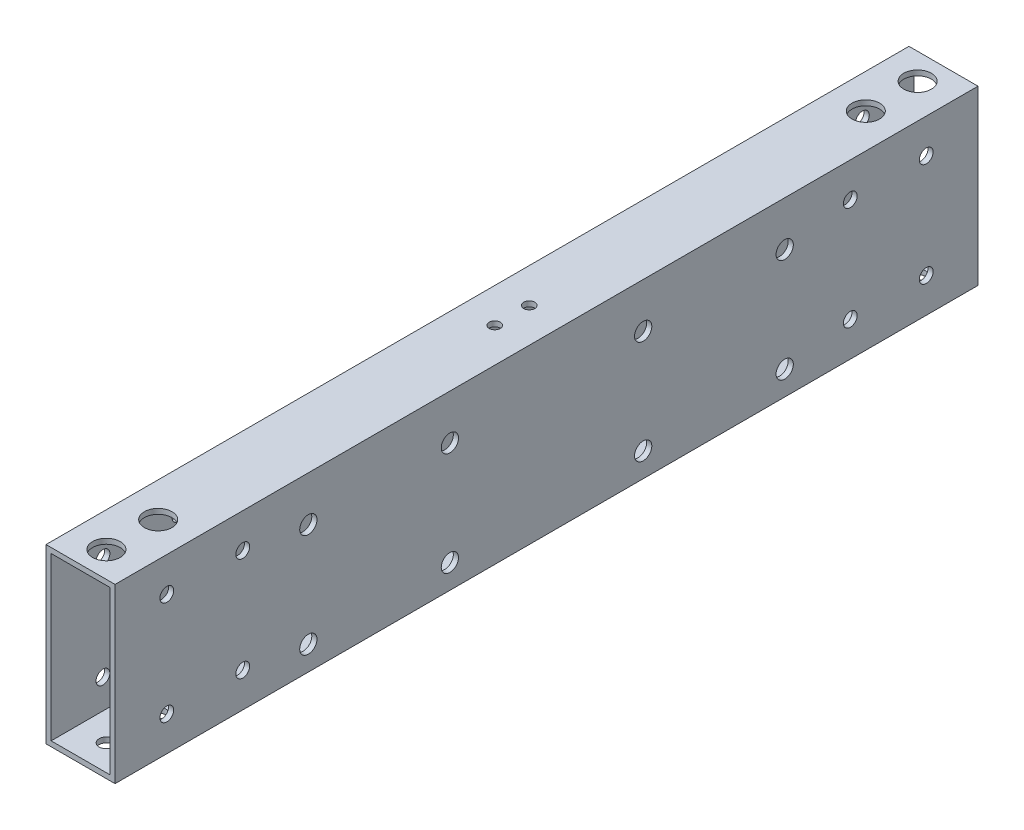
from build123d import *

# Parameters (mm, degrees)
SKETCH_1_W          = 20
SKETCH_1_H          = 50
SKETCH_1_W_2        = 17
SKETCH_1_H_2        = 47
EXTRUDE_1_DEPTH     = 250
SKETCH_2_R          = 2.5
CUT_EXTRUDE_1_DEPTH = 253.041663223
SKETCH_3_R          = 2.1
CUT_EXTRUDE_2_DEPTH = 256.147016443
SKETCH_4_R          = 1.6
CUT_EXTRUDE_3_DEPTH = 10
SKETCH_5_R          = 4
CUT_EXTRUDE_4_DEPTH = 10
SKETCH_6_R          = 7.5
CUT_EXTRUDE_5_DEPTH = 10
SKETCH_7_R          = 2
CUT_EXTRUDE_6_DEPTH = 253.041663223


with BuildPart() as part:
    # 草图1 → 凸台-拉伸1 (new body)
    with BuildSketch(Plane.XY):
        Rectangle(SKETCH_1_W, SKETCH_1_H)
        Rectangle(SKETCH_1_W_2, SKETCH_1_H_2, mode=Mode.SUBTRACT)
    extrude(amount=-EXTRUDE_1_DEPTH)

    # 草图2 → 切除-拉伸1 (cut, through all)
    with BuildSketch(Plane.ZY.offset(10)):
        with Locations((-56, 12)):
            Circle(SKETCH_2_R)
        with Locations((-97, 12)):
            Circle(SKETCH_2_R)
        with Locations((-97, -18)):
            Circle(SKETCH_2_R)
        with Locations((-56, -18)):
            Circle(SKETCH_2_R)
        with Locations((-194, -18)):
            Circle(SKETCH_2_R)
        with Locations((-153, -18)):
            Circle(SKETCH_2_R)
        with Locations((-153, 12)):
            Circle(SKETCH_2_R)
        with Locations((-194, 12)):
            Circle(SKETCH_2_R)
    extrude(amount=-CUT_EXTRUDE_1_DEPTH, mode=Mode.SUBTRACT)

    # 草图3 → 切除-拉伸2 (cut, through all)
    with BuildSketch(Plane(origin=(0, 25, 0), x_dir=(1, 0, 0), z_dir=(0, 1, 0))):
        with Locations((0, 22.5)):
            Circle(SKETCH_3_R)
        with Locations((0, 7.5)):
            Circle(SKETCH_3_R)
        with Locations((0, 242.5)):
            Circle(SKETCH_3_R)
        with Locations((0, 227.5)):
            Circle(SKETCH_3_R)
    extrude(amount=-CUT_EXTRUDE_2_DEPTH, mode=Mode.SUBTRACT)

    # 草图4 → 切除-拉伸3 (cut)
    with BuildSketch(Plane(origin=(0, 25, 0), x_dir=(1, 0, 0), z_dir=(0, 1, 0))):
        with Locations((0, 130)):
            Circle(SKETCH_4_R)
        with Locations((0, 120)):
            Circle(SKETCH_4_R)
    extrude(amount=-CUT_EXTRUDE_3_DEPTH, mode=Mode.SUBTRACT)

    # 草图5 → 切除-拉伸4 (cut)
    with BuildSketch(Plane(origin=(0, 25, 0), x_dir=(1, 0, 0), z_dir=(0, 1, 0))):
        with Locations((0, 22.5)):
            Circle(SKETCH_5_R)
        with Locations((0, 7.5)):
            Circle(SKETCH_5_R)
        with Locations((0, 242.5)):
            Circle(SKETCH_5_R)
        with Locations((0, 227.5)):
            Circle(SKETCH_5_R)
    extrude(amount=-CUT_EXTRUDE_4_DEPTH, mode=Mode.SUBTRACT)

    # 草图6 → 切除-拉伸5 (cut)
    with BuildSketch(Plane.ZY.offset(10)):
        with Locations((-125, -4)):
            Circle(SKETCH_6_R)
    extrude(amount=-CUT_EXTRUDE_5_DEPTH, mode=Mode.SUBTRACT)

    # 草图7 → 切除-拉伸6 (cut, through all)
    with BuildSketch(Plane.ZY.offset(10)):
        with Locations((-235, 15)):
            Circle(SKETCH_7_R)
        with Locations((-213, 15)):
            Circle(SKETCH_7_R)
        with Locations((-235, -15)):
            Circle(SKETCH_7_R)
        with Locations((-213, -15)):
            Circle(SKETCH_7_R)
        with Locations((-37, -15)):
            Circle(SKETCH_7_R)
        with Locations((-15, -15)):
            Circle(SKETCH_7_R)
        with Locations((-37, 15)):
            Circle(SKETCH_7_R)
        with Locations((-15, 15)):
            Circle(SKETCH_7_R)
    extrude(amount=-CUT_EXTRUDE_6_DEPTH, mode=Mode.SUBTRACT)


solid = part.part
